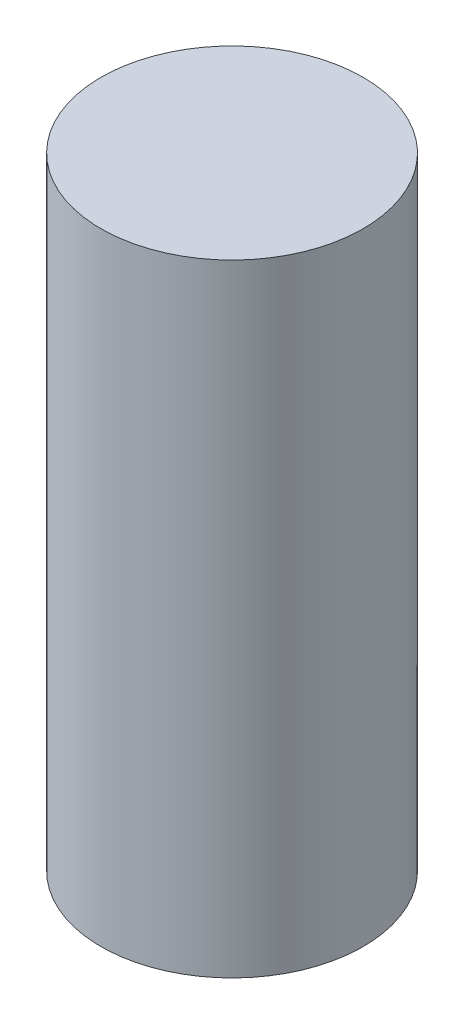
from build123d import *

# Parameters (mm, degrees)
SKETCH1_R           = 12.7
BOSS_EXTRUDE1_DEPTH = 60.21197


with BuildPart() as part:
    # Sketch1 → Boss-Extrude1 (new body)
    with BuildSketch(Plane(origin=(0, 0, 0), x_dir=(1, 0, 0), z_dir=(0, 1, 0))):
        Circle(SKETCH1_R)
    extrude(amount=BOSS_EXTRUDE1_DEPTH)


solid = part.part
